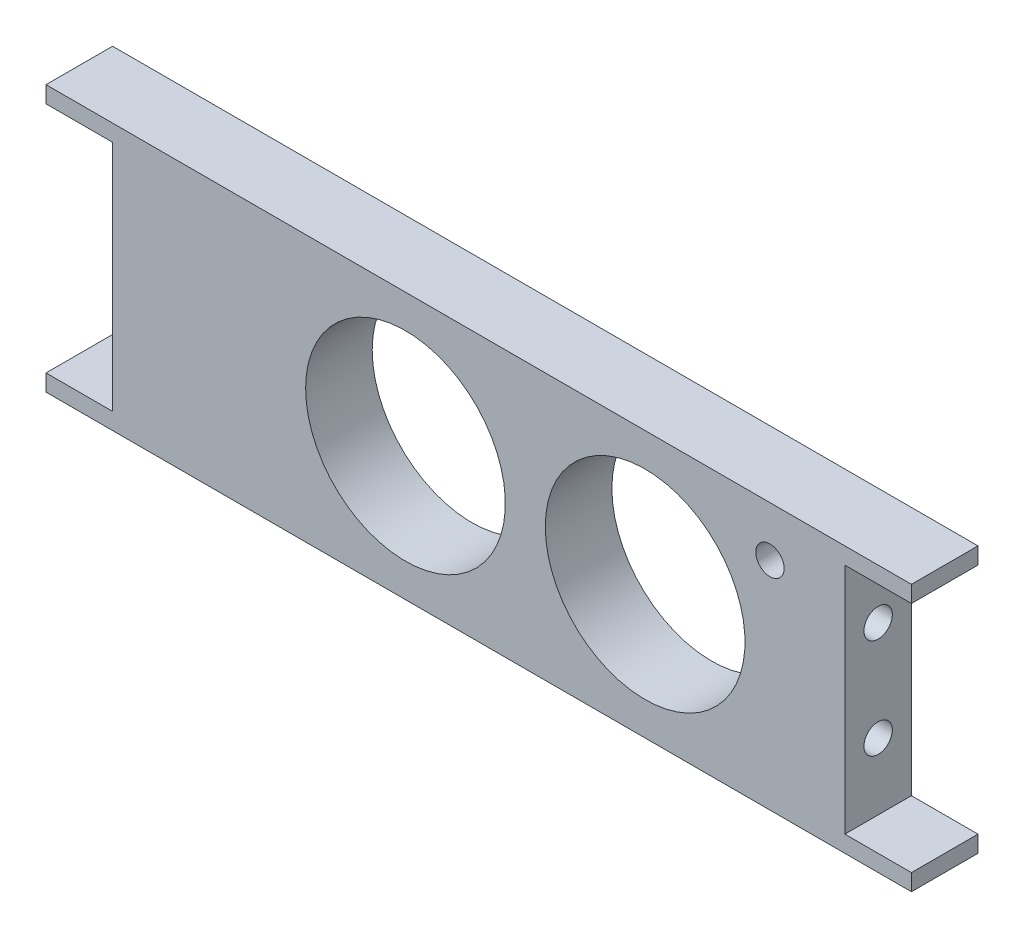
from build123d import *

# Parameters (mm, degrees)
BOSS_EXTRUDE1_DEPTH                = 6.35
TAP_DRILL_FOR_6_32_TAP1_AT_2_COUNT = 2
TAP_DRILL_FOR_6_32_TAP1_AT_2_PITCH = 9.525
SKETCH5_R                          = 9.525
CUT_EXTRUDE1_DEPTH                 = 44.649033494
TAP_DRILL_FOR_6_32_TAP2_D          = 2.7051


with BuildPart() as part:
    # Sketch1 → Boss-Extrude1 (new body)
    with BuildSketch(Plane.XY):
        Polygon((-41.275, -12.7), (41.275, -12.7), (41.275, -11.1125), (34.925, -11.1125), (34.925, 11.1125), (41.275, 11.1125), (41.275, 12.7), (-41.275, 12.7), (-41.275, 11.1125), (-34.925, 11.1125), (-34.925, -11.1125), (-41.275, -11.1125), align=None)
    extrude(amount=BOSS_EXTRUDE1_DEPTH)

    # Sketch4 → Tap Drill for #6-32 Tap1 (revolve, cut)
    with BuildSketch(Plane(origin=(34.925, 4.7625, 3.175), x_dir=(0, 0, -1), z_dir=(0, 1, 0))):
        Polygon((0, 0), (0, 7.16269403), (1.35255, 6.35), (1.35255, 0), align=None)
    tap_drill_for_6_32_tap1 = revolve(axis=Axis((41.275, 4.7625, 3.175), (-1, 0, 0)), mode=Mode.SUBTRACT)

    # Tap Drill for #6-32 Tap1 at 2: Tap Drill for #6-32 Tap1 ×2
    with Locations(*[(0, -i * TAP_DRILL_FOR_6_32_TAP1_AT_2_PITCH, 0) for i in range(1, TAP_DRILL_FOR_6_32_TAP1_AT_2_COUNT)]):
        add(tap_drill_for_6_32_tap1, mode=Mode.SUBTRACT)

    # Mirror1: Tap Drill for #6-32 Tap1 across plane
    add(tap_drill_for_6_32_tap1.mirror(Plane.ZY), mode=Mode.SUBTRACT)

    # Mirror1 copy 1 sketch → Mirror1 copy 1 (revolve, cut)
    with BuildSketch(Plane(origin=(-34.925, -4.7625, 3.175), x_dir=(0, 0, -1), z_dir=(0, 1, 0))):
        Polygon((0, 0), (0, -7.16269403), (1.35255, -6.35), (1.35255, 0), align=None)
    revolve(axis=Axis((-41.275, -4.7625, 3.175), (-1, 0, 0)), mode=Mode.SUBTRACT)

    # Sketch5 → Cut-Extrude1 (cut, through all)
    with BuildSketch(Plane(origin=(0, 0, 0), x_dir=(-1, 0, 0), z_dir=(0, 0, -1))):
        with Locations((6.985, 0)):
            Circle(SKETCH5_R)
        with Locations((-15.875, 0)):
            Circle(SKETCH5_R)
    extrude(amount=-CUT_EXTRUDE1_DEPTH, mode=Mode.SUBTRACT)

    # Tap Drill for #6-32 Tap2 (through all)
    with Locations(Plane(origin=(0, 0, 0), x_dir=(-1, 0, 0), z_dir=(0, 0, -1))):
        with Locations((-27.78125, 7.9375)):
            Hole(TAP_DRILL_FOR_6_32_TAP2_D / 2)


solid = part.part
